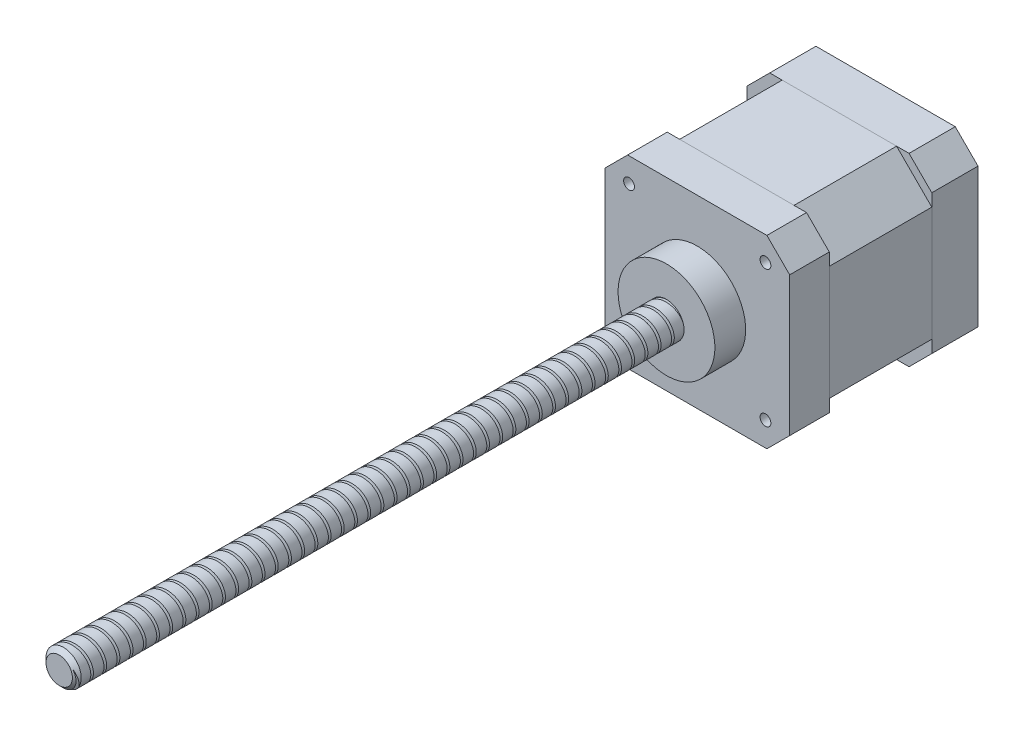
from build123d import *

# Parameters (mm, degrees)
BOSS_EXTRUDE1_DEPTH  = 10.5
BOSS_EXTRUDE2_DEPTH  = 23.3
BOSS_EXTRUDE3_DEPTH  = 9
HOLE1_D              = 2.459
HOLE1_DEPTH          = 5
HOLE2_D              = 2.459
HOLE2_DEPTH          = 5
HOLE3_D              = 2.459
HOLE3_DEPTH          = 5
HOLE4_D              = 2.459
HOLE4_DEPTH          = 5
CORTAR_BARRER1_PITCH = 3
CHAFL_N1_SIZE        = 1


with BuildPart() as part:
    # Sketch1 → Boss-Extrude1 (new body)
    with BuildSketch(Plane(origin=(0, 0, 0), x_dir=(-1, 0, 0), z_dir=(0, 0, -1))):
        Polygon((-15.828427125, 21), (-21, 15.828427125), (-21, -15.828427125), (-15.828427125, -21), (15.828427125, -21), (21, -15.828427125), (21, 15.828427125), (15.828427125, 21), align=None)
    extrude(amount=-BOSS_EXTRUDE1_DEPTH)

    # Sketch2 → Boss-Extrude2 (add)
    with BuildSketch(Plane.XY.offset(10.5)):
        Polygon((13, -21), (-13, -21), (-21, -13), (-21, 13), (-13, 21), (13, 21), (21, 13), (21, -13), align=None)
    extrude(amount=BOSS_EXTRUDE2_DEPTH)

    # Sketch3 → Boss-Extrude3 (add)
    with BuildSketch(Plane.XY.offset(33.8)):
        Polygon((15.828427125, 21), (21, 15.828427125), (21, -15.828427125), (15.828427125, -21), (-15.828427125, -21), (-21, -15.828427125), (-21, 15.828427125), (-15.828427125, 21), align=None)
    extrude(amount=BOSS_EXTRUDE3_DEPTH)

    # Sketch8 → Revolve5 (revolve)
    with BuildSketch(Plane.XZ, mode=Mode.PRIVATE) as revolve5_sk:
        Polygon((4, 187.8), (0, 187.8), (0, 42.8), (11, 42.8), (11, 49.8), (4, 49.8), align=None)
    revolve(revolve5_sk.sketch.rotate(Axis((0, 0, 187.8), (0, 0, -1)), 180), axis=Axis((0, 0, 187.8), (0, 0, -1)))

    # Hole1
    with Locations(Plane.XY.offset(42.8)):
        with Locations((-15.5, 15.5)):
            Hole(HOLE1_D / 2, depth=HOLE1_DEPTH)

    # Hole2
    with Locations(Plane.XY.offset(42.8)):
        with Locations((-15.5, -15.5)):
            Hole(HOLE2_D / 2, depth=HOLE2_DEPTH)

    # Hole3
    with Locations(Plane.XY.offset(42.8)):
        with Locations((15.5, 15.5)):
            Hole(HOLE3_D / 2, depth=HOLE3_DEPTH)

    # Hole4
    with Locations(Plane.XY.offset(42.8)):
        with Locations((15.5, -15.5)):
            Hole(HOLE4_D / 2, depth=HOLE4_DEPTH)

    # Cortar-Barrer1: arcs per turn and ends read off the stored shape
    # Cortar-Barrer1: the profile of Croquis1 profile screwed along a right-hand helix through 81 turns, 6 arcs to a turn; built about Z, then put on its axis
    cortar_barrer1_z = Axis((0, 0, 0), (0, 0, 1))
    cortar_barrer1_corners = [(4.0003, 0, -3.6001125), (3.2, 0, -3.3), (4.0003, 0, -2.9998875)]
    with BuildLine(mode=Mode.PRIVATE) as cortar_barrer1_profile:
        Line(cortar_barrer1_corners[0], cortar_barrer1_corners[1])
        Line(cortar_barrer1_corners[1], cortar_barrer1_corners[2])
        Line(cortar_barrer1_corners[2], cortar_barrer1_corners[0])
    cortar_barrer1_cap = Face(cortar_barrer1_profile.wire())
    cortar_barrer1_turn_angles = [0, 30, 60, 90, 120, 150, 180, 210, 240, 270, 300, 330, 360]
    cortar_barrer1_turn_weights = [1, 0.8660254037844387, 1, 0.8660254037844387, 1, 0.8660254037844387, 1, 0.8660254037844387, 1, 0.8660254037844387, 1, 0.8660254037844387, 1]
    cortar_barrer1_turn_rails = [Edge.make_bspline([Vector(p[0], p[1], 0).rotate(cortar_barrer1_z, cortar_barrer1_turn_angles[k]) / cortar_barrer1_turn_weights[k] + Vector(0, 0, p[2] + CORTAR_BARRER1_PITCH * cortar_barrer1_turn_angles[k] / 360) for k in range(13)], [0, 0, 0, 1, 1, 2, 2, 3, 3, 4, 4, 5, 5, 6, 6, 6], 2, cortar_barrer1_turn_weights) for p in cortar_barrer1_corners]
    cortar_barrer1_turn_sides = [Face.make_surface_from_curves(cortar_barrer1_turn_rails[p[0]], cortar_barrer1_turn_rails[p[1]]) for p in [(0, 1), (1, 2), (2, 0)]]
    cortar_barrer1 = Plane(origin=(0, 0, 187.8), x_dir=(0, 1, 0), z_dir=(0, 0, -1)) * Solid(Shell([*[p.moved(Location((0, 0, CORTAR_BARRER1_PITCH * i))) for i in range(81) for p in cortar_barrer1_turn_sides], cortar_barrer1_cap, cortar_barrer1_cap.rotate(cortar_barrer1_z, 29160).moved(Location((0, 0, CORTAR_BARRER1_PITCH * 29160 / 360)))]))
    add(cortar_barrer1, mode=Mode.SUBTRACT)

    # Chaflán1
    # the kernel refuses this chamfer: 1 mm, written as the material it takes off along each edge
    with BuildSketch(Plane(origin=(0, 0, 187.8), x_dir=(-0.9999802608561371, 0.006283143965559326, 0), z_dir=(-0.006283143965559326, -0.9999802608561371, 0))) as chafl_n1_piece_1:
        Polygon((4, CHAFL_N1_SIZE), (4 - CHAFL_N1_SIZE, 0), (4, 0), align=None)
    revolve(axis=Axis((0, 0, 187.8), (0, 0, -1)), revolution_arc=359.64, mode=Mode.SUBTRACT)
    with BuildSketch(Plane(origin=(0, 0, 187.8), x_dir=(-1, 0, 0), z_dir=(0, -1, 0))) as chafl_n1_piece_2:
        Polygon((4, CHAFL_N1_SIZE), (4 - CHAFL_N1_SIZE, 0), (4, 0), align=None)
    revolve(axis=Axis((0, 0, 187.8), (0, 0, -1)), revolution_arc=274.257214724, mode=Mode.SUBTRACT)


solid = part.part
